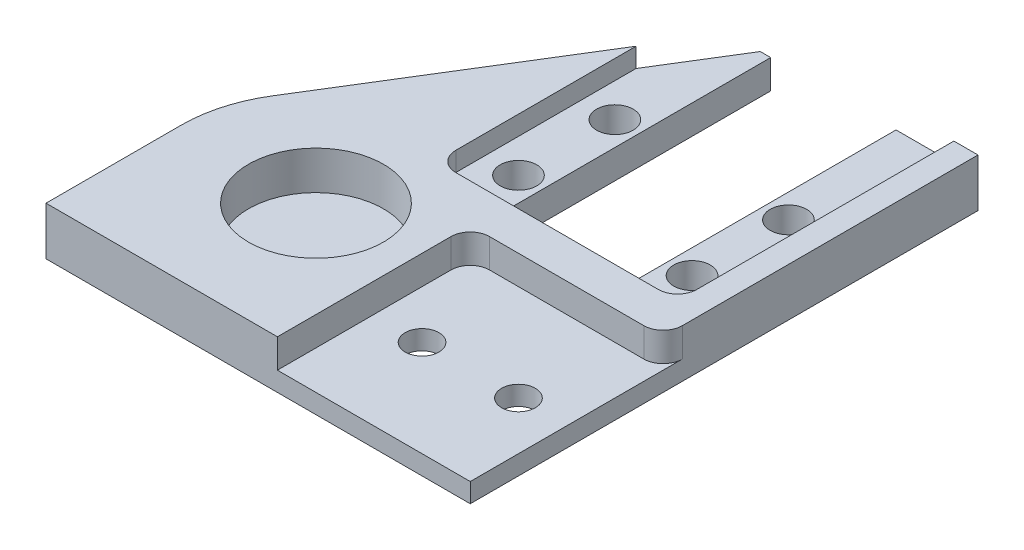
from build123d import *

# Parameters (mm, degrees)
SKETCH_1_W           = 35
SKETCH_1_H           = 55
EXTRUDE_1_DEPTH      = 1
EXTRUDE_2_DEPTH      = 3
SKETCH_3_R           = 5
CUT_EXTRUDE_1_DEPTH  = 169.569903897
SKETCH_4_R           = 4
CUT_EXTRUDE_2_DEPTH  = 2
SKETCH_5_R           = 2
CUT_EXTRUDE_3_DEPTH  = 2
EXTRUDE_START        = 7
EXTRUDE_3_DEPTH      = 7
CUT_EXTRUDE_START    = -1.5
SKETCH_9_W           = 10
SKETCH_9_H           = 26
CUT_EXTRUDE_4_DEPTH  = 168.318874833
SKETCH_10_R          = 1.5
CUT_EXTRUDE_5_DEPTH  = 194.595583627
EXTRUDE_4_DEPTH      = 3
SKETCH_13_W          = 334.012533363
SKETCH_13_H          = 161.456209481
CUT_EXTRUDE_6_DEPTH  = 10
CUT_EXTRUDE_START_2  = -0.5
SKETCH_14_R          = 3.5
CUT_EXTRUDE_7_DEPTH  = 179.354165453
SKETCH_15_R          = 5
CUT_EXTRUDE_8_DEPTH  = 179.854165453
EXTRUDE_START_2      = -3
EXTRUDE_5_DEPTH      = 16
EXTRUDE_7_DEPTH      = 7
SKETCH_24_W          = 10
SKETCH_24_H          = 26
CUT_EXTRUDE_11_DEPTH = 180.209193181
SKETCH_25_R          = 1.5
CUT_EXTRUDE_12_DEPTH = 176.793913433
THREAD_2_PITCH       = 0.6
CUT_EXTRUDE_13_DEPTH = 181.709193232
EXTRUDE_START_3      = 2
SKETCH_27_R          = 5
EXTRUDE_8_DEPTH      = 2
CUT_EXTRUDE_START_3  = -2
SKETCH_28_W          = 25
SKETCH_28_H          = 47.640496167
CUT_EXTRUDE_14_DEPTH = 182.247184378
SKETCH_29_R          = 7
CUT_EXTRUDE_15_DEPTH = 4
CUT_EXTRUDE_16_DEPTH = 10
SKETCH_32_R          = 1.896812978
CUT_EXTRUDE_17_DEPTH = 10
CUT_EXTRUDE_START_4  = -19
CUT_EXTRUDE_18_DEPTH = 2
CUT_EXTRUDE_19_DEPTH = 180.762490825
CUT_EXTRUDE_20_DEPTH = 176.782687167
CUT_EXTRUDE_21_DEPTH = 175.343166372
SKETCH_37_R          = 1
CUT_EXTRUDE_22_DEPTH = 175.199743974
EXTRUDE_START_4      = -1
SKETCH_39_R          = 5
EXTRUDE_9_DEPTH      = 1
SKETCH_40_W          = 2.395962652
SKETCH_40_H          = 5.687033247
CUT_EXTRUDE_23_DEPTH = 192.518571686
SKETCH_41_W          = 84.482618637
SKETCH_41_H          = 34.951738984
CUT_EXTRUDE_24_DEPTH = 192.518571686
SKETCH_42_W          = 20
SKETCH_42_H          = 3
CUT_EXTRUDE_25_DEPTH = 20
CUT_EXTRUDE_26_DEPTH = 20
FILLET_1_R           = 2
FILLET_2_R           = 2


with BuildPart() as part:
    # 草图1 → 凸台-拉伸1 (new body)
    with BuildSketch(Plane(origin=(0, 0, 0), x_dir=(1, 0, 0), z_dir=(0, 1, 0))):
        Rectangle(SKETCH_1_W, SKETCH_1_H)
    extrude(amount=EXTRUDE_1_DEPTH)

    # Sketch 2 → 凸台-拉伸2 (add)
    with BuildSketch(Plane(origin=(0, 1, 0), x_dir=(1, 0, 0), z_dir=(0, 1, 0))):
        with BuildLine():
            Line((106.75, -2.25), (106.75, 2.25))
            Line((106.75, 2.25), (121.75, 2.25))
            ThreePointArc((121.75, 2.25), (122.922125199, 2.352547667), (124.058635967, 2.65707481))
            Line((124.058635967, 2.65707481), (154.058635967, 13.576181838))
            ThreePointArc((154.058635967, 13.576181838), (158.397452333, 21.091232227), (151.75, 26.669107028))
            Line((151.75, 26.669107028), (-31.447415548, 57.101298968))
            ThreePointArc((-31.447415548, 57.101298968), (-37.800418235, 56.264673928), (-42.609265279, 52.029632639))
            Line((-42.609265279, 52.029632639), (-60.161792173, 23.605896086))
            ThreePointArc((-60.161792173, 23.605896086), (-61.717833724, 20.073278016), (-62.25, 16.25))
            Line((-62.25, 16.25), (-62.25, -16.25))
            ThreePointArc((-62.25, -16.25), (-61.717833724, -20.073278016), (-60.161792173, -23.605896086))
            Line((-60.161792173, -23.605896086), (-42.609265279, -52.029632639))
            ThreePointArc((-42.609265279, -52.029632639), (-37.800418235, -56.264673928), (-31.447415548, -57.101298968))
            Line((-31.447415548, -57.101298968), (151.75, -26.669107028))
            ThreePointArc((151.75, -26.669107028), (158.397452333, -21.091232227), (154.058635967, -13.576181838))
            Line((154.058635967, -13.576181838), (124.058635967, -2.65707481))
            ThreePointArc((124.058635967, -2.65707481), (122.922125199, -2.352547667), (121.75, -2.25))
            Line((121.75, -2.25), (106.75, -2.25))
        make_face()
    extrude(amount=EXTRUDE_2_DEPTH)

    # 草图3 → 切除-拉伸1 (cut, through all)
    with BuildSketch(Plane(origin=(0, 4, 0), x_dir=(1, 0, 0), z_dir=(0, 1, 0))):
        with Locations(Location((-48.25, 16.25, 0), (0, 0, 270))):
            Circle(SKETCH_3_R)
        with Locations(Location((-48.25, -16.25, 0), (0, 0, 270))):
            Circle(SKETCH_3_R)
    extrude(amount=-CUT_EXTRUDE_1_DEPTH, mode=Mode.SUBTRACT)

    # 草图4 → 切除-拉伸2 (cut)
    with BuildSketch(Plane(origin=(0, 4, 0), x_dir=(1, 0, 0), z_dir=(0, 1, 0))):
        with Locations(Location((-33.25, 46.25, 0), (0, 0, 270))):
            Circle(SKETCH_4_R)
        with Locations(Location((-33.25, -46.25, 0), (0, 0, 270))):
            Circle(SKETCH_4_R)
    extrude(amount=-CUT_EXTRUDE_2_DEPTH, mode=Mode.SUBTRACT)

    # 草图5 → 切除-拉伸3 (cut)
    with BuildSketch(Plane(origin=(0, 4, 0), x_dir=(1, 0, 0), z_dir=(0, 1, 0))):
        with Locations(Location((121.75, 9, 0), (0, 0, 270))):
            Circle(SKETCH_5_R)
        with Locations(Location((121.75, -9, 0), (0, 0, 270))):
            Circle(SKETCH_5_R)
        with Locations(Location((151.75, 19.919107028, 0), (0, 0, 270))):
            Circle(SKETCH_5_R)
        with Locations(Location((151.75, -19.919107028, 0), (0, 0, 270))):
            Circle(SKETCH_5_R)
    extrude(amount=-CUT_EXTRUDE_3_DEPTH, mode=Mode.SUBTRACT)

    # 草图8 → 凸台-拉伸3 (add)
    with BuildSketch(Plane.XZ.offset(-1).offset(EXTRUDE_START)):
        with BuildLine():
            Line((-26.75, -26.25), (-39.75, -26.25))
            Line((-39.75, -26.25), (-39.75, -55.124119675))
            ThreePointArc((-39.75, -55.124119675), (-35.798281322, -56.950759894), (-31.447415548, -57.101298968))
            Line((-31.447415548, -57.101298968), (-26.75, -56.320978726))
            Line((-26.75, -56.320978726), (-26.75, -26.25))
        make_face()
    extrude_3 = extrude(amount=-EXTRUDE_3_DEPTH)

    # 镜向1: 凸台-拉伸3 across plane
    add(extrude_3.mirror(Plane.XY))

    # 草图9 → 切除-拉伸4 (cut, through all)
    with BuildSketch(Plane.XZ.offset(6).offset(CUT_EXTRUDE_START)):
        with Locations((-33.25, -40.75)):
            Rectangle(SKETCH_9_W, SKETCH_9_H)
    cut_extrude_4 = extrude(amount=-CUT_EXTRUDE_4_DEPTH, mode=Mode.SUBTRACT)

    # 镜向2: 切除-拉伸4 across plane
    add(cut_extrude_4.mirror(Plane.XY), mode=Mode.SUBTRACT)

    # 草图10 → 切除-拉伸5 (cut, through all)
    with BuildSketch(Plane.XY.offset(-53.75)):
        with Locations((-33.25, -1.5)):
            Circle(SKETCH_10_R)
    cut_extrude_5 = extrude(amount=-CUT_EXTRUDE_5_DEPTH, mode=Mode.SUBTRACT)

    # 镜向3: 切除-拉伸5 across plane
    add(cut_extrude_5.mirror(Plane.XY), mode=Mode.SUBTRACT)

    # 草图12 → 凸台-拉伸4 (add)
    with BuildSketch(Plane(origin=(0, 4, 0), x_dir=(1, 0, 0), z_dir=(0, 1, 0))):
        with BuildLine():
            Line((152.536154407, 34.648141662), (-30.136445037, 64.993152763))
            ThreePointArc((-30.136445037, 64.993152763), (-32.296727103, 65.226071005), (-34.469475839, 65.210824842))
            Line((-34.469475839, 65.210824842), (-60.161792173, 23.605896086))
            ThreePointArc((-60.161792173, 23.605896086), (-61.717833724, 20.073278016), (-62.25, 16.25))
            Line((-62.25, 16.25), (-62.25, 2.25))
            Line((-62.25, 2.25), (121.75, 2.25))
            ThreePointArc((121.75, 2.25), (122.922125199, 2.352547667), (124.058635967, 2.65707481))
            Line((124.058635967, 2.65707481), (166.382589153, 18.061733966))
            ThreePointArc((166.382589153, 18.061733966), (163.073058037, 29.371665237), (152.536154407, 34.648141662))
        make_face()
    extrude(amount=EXTRUDE_4_DEPTH)

    # 草图13 → 切除-拉伸6 (cut)
    with BuildSketch(Plane.XZ.offset(-4)):
        with Locations((47.836319436, 6.16656882)):
            Rectangle(SKETCH_13_W, SKETCH_13_H)
    extrude(amount=CUT_EXTRUDE_6_DEPTH, mode=Mode.SUBTRACT)

    # 草图14 → 切除-拉伸7 (cut, through all)
    with BuildSketch(Plane.XZ.offset(-4).offset(CUT_EXTRUDE_START_2)):
        with Locations(Location((151.75, -19.919107028, 0), (0, 0, 270))):
            Circle(SKETCH_14_R)
        with Locations(Location((121.75, -9, 0), (0, 0, 270))):
            Circle(SKETCH_14_R)
    extrude(amount=-CUT_EXTRUDE_7_DEPTH, mode=Mode.SUBTRACT)

    # 草图15 → 切除-拉伸8 (cut, through all)
    with BuildSketch(Plane.XZ.offset(-4)):
        with Locations(Location((-48.25, -16.25, 0), (0, 0, 270))):
            Circle(SKETCH_15_R)
    extrude(amount=-CUT_EXTRUDE_8_DEPTH, mode=Mode.SUBTRACT)

    # 草图17 → 凸台-拉伸5 (add)
    with BuildSketch(Plane.XZ.offset(-4).offset(EXTRUDE_START_2)):
        with BuildLine():
            Line((-30.628058978, -62.03370759), (152.218782473, -31.659751942))
            ThreePointArc((152.218782473, -31.659751942), (161.216553887, -26.879484712), (163.096310198, -16.865626245))
            Line((163.096310198, -16.865626245), (166.382589153, -18.061733966))
            ThreePointArc((166.382589153, -18.061733966), (163.073058037, -29.371665237), (152.536154407, -34.648141662))
            Line((152.536154407, -34.648141662), (-30.136445037, -64.993152763))
            ThreePointArc((-30.136445037, -64.993152763), (-32.296727103, -65.226071005), (-34.469475839, -65.210824842))
            Line((-34.469475839, -65.210824842), (-36.504423199, -61.915526791))
            ThreePointArc((-36.504423199, -61.915526791), (-33.571714316, -62.246765295), (-30.628058978, -62.03370759))
        make_face()
    extrude(amount=-EXTRUDE_5_DEPTH)

    # 草图23 → 凸台-拉伸7 (add)
    with BuildSketch(Plane.XZ.offset(-4).offset(EXTRUDE_START)):
        with BuildLine():
            Line((-39.75, -56.65979236), (-39.75, -26.25))
            Line((-39.75, -26.25), (-26.75, -26.25))
            Line((-26.75, -26.25), (-26.75, -64.430606916))
            Line((-26.75, -64.430606916), (-30.136445037, -64.993152763))
            ThreePointArc((-30.136445037, -64.993152763), (-32.296727103, -65.226071005), (-34.469475839, -65.210824842))
            Line((-34.469475839, -65.210824842), (-39.75, -56.65979236))
        make_face()
    extrude(amount=-EXTRUDE_7_DEPTH)

    # 草图24 → 切除-拉伸11 (cut, through all)
    with BuildSketch(Plane.XZ.offset(3).offset(CUT_EXTRUDE_START)):
        with Locations((-33.25, -40.75)):
            Rectangle(SKETCH_24_W, SKETCH_24_H)
    extrude(amount=-CUT_EXTRUDE_11_DEPTH, mode=Mode.SUBTRACT)

    # 草图25 → 切除-拉伸12 (cut, through all)
    with BuildSketch(Plane.XY.offset(-53.75)):
        with Locations((-33.25, 1.5)):
            Circle(SKETCH_25_R)
    extrude(amount=-CUT_EXTRUDE_12_DEPTH, mode=Mode.SUBTRACT)

    # 螺纹线2: the profile of Sketch 2 2 profile screwed along a right-hand helix of 25 turns, 6 arcs to a turn; built about Z, then put on its axis
    thread_2_z = Axis((0, 0, 0), (0, 0, 1))
    thread_2_corners = [(1.4997, 0, -0.000173205), (1.824759525, 0, 0.187499999), (1.824759525, 0, 0.262499999), (1.4997, 0, 0.450173203)]
    with BuildLine(mode=Mode.PRIVATE) as thread_2_profile:
        Line(thread_2_corners[0], thread_2_corners[1])
        Line(thread_2_corners[1], thread_2_corners[2])
        Line(thread_2_corners[2], thread_2_corners[3])
        Line(thread_2_corners[3], thread_2_corners[0])
    thread_2_cap = Face(thread_2_profile.wire())
    thread_2_turn_angles = [0, 30, 60, 90, 120, 150, 180, 210, 240, 270, 300, 330, 360]
    thread_2_turn_weights = [1, 0.8660254037844387, 1, 0.8660254037844387, 1, 0.8660254037844387, 1, 0.8660254037844387, 1, 0.8660254037844387, 1, 0.8660254037844387, 1]
    thread_2_turn_rails = [Edge.make_bspline([Vector(p[0], p[1], 0).rotate(thread_2_z, thread_2_turn_angles[k]) / thread_2_turn_weights[k] + Vector(0, 0, p[2] + THREAD_2_PITCH * thread_2_turn_angles[k] / 360) for k in range(13)], [0, 0, 0, 1, 1, 2, 2, 3, 3, 4, 4, 5, 5, 6, 6, 6], 2, thread_2_turn_weights) for p in thread_2_corners]
    thread_2_turn_sides = [Face.make_surface_from_curves(thread_2_turn_rails[p[0]], thread_2_turn_rails[p[1]]) for p in [(0, 1), (1, 2), (2, 3), (3, 0)]]
    thread_2 = Plane(origin=(-33.25, 1.5, -53.75), x_dir=(-1, 0, 0), z_dir=(0, 0, -1)) * Solid(Shell([*[p.moved(Location((0, 0, THREAD_2_PITCH * i))) for i in range(25) for p in thread_2_turn_sides], thread_2_cap, thread_2_cap.rotate(thread_2_z, 9000).moved(Location((0, 0, THREAD_2_PITCH * 9000 / 360)))]))
    add(thread_2, mode=Mode.SUBTRACT)

    # 草图26 → 切除-拉伸13 (cut, through all)
    with BuildSketch(Plane.XZ.offset(3)):
        with BuildLine():
            Line((-26.75, -64.430606916), (-26.75, -26.25))
            Line((-26.75, -26.25), (-39.75, -26.25))
            Line((-39.75, -26.25), (-39.75, -56.65979236))
            Line((-39.75, -56.65979236), (-34.469475839, -65.210824842))
            ThreePointArc((-34.469475839, -65.210824842), (-32.296727103, -65.226071005), (-30.136445037, -64.993152763))
            Line((-30.136445037, -64.993152763), (-26.75, -64.430606916))
        make_face()
    extrude(amount=-CUT_EXTRUDE_13_DEPTH, mode=Mode.SUBTRACT)

    # 草图27 → 凸台-拉伸8 (add)
    with BuildSketch(Plane.XZ.offset(-4).offset(EXTRUDE_START_3)):
        with BuildLine():
            Line((-39.75, -56.65979236), (-39.75, -26.25))
            Line((-39.75, -26.25), (-26.75, -26.25))
            Line((-26.75, -26.25), (-26.75, -64.430606916))
            Line((-26.75, -64.430606916), (-18.25, -63.018613025))
            Line((-18.25, -63.018613025), (-18.25, -2.25))
            Line((-18.25, -2.25), (-62.25, -2.25))
            Line((-62.25, -2.25), (-62.25, -16.25))
            ThreePointArc((-62.25, -16.25), (-61.717833724, -20.073278016), (-60.161792173, -23.605896086))
            Line((-60.161792173, -23.605896086), (-39.75, -56.65979236))
        make_face()
        with Locations(Location((-48.25, -16.25, 0), (0, 0, 270))):
            Circle(SKETCH_27_R, mode=Mode.SUBTRACT)
    extrude(amount=-EXTRUDE_8_DEPTH)

    # 草图28 → 切除-拉伸14 (cut, through all)
    with BuildSketch(Plane(origin=(0, 7, 0), x_dir=(1, 0, 0), z_dir=(0, 1, 0)).offset(CUT_EXTRUDE_START_3)):
        with Locations((-33.25, 50.070248084)):
            Rectangle(SKETCH_28_W, SKETCH_28_H)
    extrude(amount=CUT_EXTRUDE_14_DEPTH, mode=Mode.SUBTRACT)

    # 草图29 → 切除-拉伸15 (cut)
    with BuildSketch(Plane(origin=(0, 7, 0), x_dir=(1, 0, 0), z_dir=(0, 1, 0))):
        with Locations(Location((-48.25, 16.25, 0), (0, 0, 270))):
            Circle(SKETCH_29_R)
    extrude(amount=-CUT_EXTRUDE_15_DEPTH, mode=Mode.SUBTRACT)

    # 草图31 → 切除-拉伸16 (cut)
    with BuildSketch(Plane.XZ.offset(-4)):
        with BuildLine():
            Line((7.5, -16.25), (0, -16.25))
            ThreePointArc((0, -16.25), (0.512563133, -17.487436867), (1.75, -18))
            Line((1.75, -18), (5.75, -18))
            ThreePointArc((5.75, -18), (6.987436867, -17.487436867), (7.5, -16.25))
        make_face()
        with BuildLine():
            ThreePointArc((1.75, -14.5), (0.512563133, -15.012563133), (0, -16.25))
            Line((0, -16.25), (7.5, -16.25))
            ThreePointArc((7.5, -16.25), (6.987436867, -15.012563133), (5.75, -14.5))
            Line((5.75, -14.5), (1.75, -14.5))
        make_face()
        with BuildLine():
            Line((47.5, -16.25), (40, -16.25))
            ThreePointArc((40, -16.25), (40.512563133, -17.487436867), (41.75, -18))
            Line((41.75, -18), (45.75, -18))
            ThreePointArc((45.75, -18), (46.987436867, -17.487436867), (47.5, -16.25))
        make_face()
        with BuildLine():
            ThreePointArc((41.75, -14.5), (40.512563133, -15.012563133), (40, -16.25))
            Line((40, -16.25), (47.5, -16.25))
            ThreePointArc((47.5, -16.25), (46.987436867, -15.012563133), (45.75, -14.5))
            Line((45.75, -14.5), (41.75, -14.5))
        make_face()
        with BuildLine():
            ThreePointArc((81.75, -14.5), (80.512563133, -15.012563133), (80, -16.25))
            Line((80, -16.25), (87.5, -16.25))
            ThreePointArc((87.5, -16.25), (86.987436867, -15.012563133), (85.75, -14.5))
            Line((85.75, -14.5), (81.75, -14.5))
        make_face()
        with BuildLine():
            Line((87.5, -16.25), (80, -16.25))
            ThreePointArc((80, -16.25), (80.512563133, -17.487436867), (81.75, -18))
            Line((81.75, -18), (85.75, -18))
            ThreePointArc((85.75, -18), (86.987436867, -17.487436867), (87.5, -16.25))
        make_face()
        with BuildLine():
            Line((0, -31.25), (0, -35.25))
            ThreePointArc((0, -35.25), (1.75, -37), (3.5, -35.25))
            Line((3.5, -35.25), (3.5, -31.25))
            ThreePointArc((3.5, -31.25), (1.75, -29.5), (0, -31.25))
        make_face()
    extrude(amount=-CUT_EXTRUDE_16_DEPTH, mode=Mode.SUBTRACT)

    # 草图32 → 切除-拉伸17 (cut)
    with BuildSketch(Plane(origin=(0, 5, 0), x_dir=(1, 0, 0), z_dir=(0, 1, 0))):
        with Locations(Location((-42.25, 41.25, 0), (0, 0, 270))):
            Circle(SKETCH_32_R)
        with Locations(Location((-42.25, 31.25, 0), (0, 0, 270))):
            Circle(SKETCH_32_R)
        with Locations(Location((-24.25, 41.25, 0), (0, 0, 270))):
            Circle(SKETCH_32_R)
        with Locations(Location((-24.25, 31.25, 0), (0, 0, 270))):
            Circle(SKETCH_32_R)
    extrude(amount=-CUT_EXTRUDE_17_DEPTH, mode=Mode.SUBTRACT)

    # 草图33 → 切除-拉伸18 (cut)
    with BuildSketch(Plane(origin=(0, 23, 0), x_dir=(1, 0, 0), z_dir=(0, 1, 0)).offset(CUT_EXTRUDE_START_4)):
        with BuildLine():
            Line((-26.75, 56.320978726), (151.75, 26.669107028))
            ThreePointArc((151.75, 26.669107028), (158.397452333, 21.091232227), (154.058635967, 13.576181838))
            Line((154.058635967, 13.576181838), (163.096310198, 16.865626245))
            Line((163.096310198, 16.865626245), (166.382589153, 18.061733966))
            ThreePointArc((166.382589153, 18.061733966), (163.073058037, 29.371665237), (152.536154407, 34.648141662))
            Line((152.536154407, 34.648141662), (-20.75, 63.433905346))
            Line((-20.75, 63.433905346), (-26.75, 64.430606916))
            Line((-26.75, 64.430606916), (-26.75, 56.320978726))
        make_face()
    extrude(amount=CUT_EXTRUDE_18_DEPTH, mode=Mode.SUBTRACT)

    # 草图34 → 切除-拉伸19 (cut, through all)
    with BuildSketch(Plane(origin=(0, 23, 0), x_dir=(1, 0, 0), z_dir=(0, 1, 0))):
        with BuildLine():
            Line((152.536154407, 34.648141662), (-20.75, 63.433905346))
            Line((-20.75, 63.433905346), (-20.75, 60.392794775))
            Line((-20.75, 60.392794775), (152.218782473, 31.659751942))
            ThreePointArc((152.218782473, 31.659751942), (161.216553887, 26.879484712), (163.096310198, 16.865626245))
            Line((163.096310198, 16.865626245), (166.382589153, 18.061733966))
            ThreePointArc((166.382589153, 18.061733966), (163.073058037, 29.371665237), (152.536154407, 34.648141662))
        make_face()
    extrude(amount=-CUT_EXTRUDE_19_DEPTH, mode=Mode.SUBTRACT)

    # 草图35 → 切除-拉伸20 (cut, through all)
    with BuildSketch(Plane.XZ.offset(-6)):
        Polygon((-20.75, -60.392794775), (-20.75, -55.324277157), (-34.501982631, -57.608714269), (-32.134133376, -71.862825995), (-8.577554705, -67.949679505), (-10.126047391, -58.627976401), align=None)
        Polygon((-10.94540396, -53.695567779), (-20.75, -55.324277157), (-20.75, -60.392794775), (-10.126047391, -58.627976401), align=None)
    extrude(amount=CUT_EXTRUDE_20_DEPTH, mode=Mode.SUBTRACT)

    # 草图36 → 切除-拉伸21 (cut, through all)
    with BuildSketch(Plane.XZ.offset(-6)):
        Polygon((-18.25, -54.908984836), (-18.25, -59.977502454), (-20.75, -60.392794775), (-20.75, -55.324277157), align=None)
    extrude(amount=-CUT_EXTRUDE_21_DEPTH, mode=Mode.SUBTRACT)

    # 草图37 → 切除-拉伸22 (cut, through all)
    with BuildSketch(Plane.XZ.offset(-6)):
        with BuildLine():
            ThreePointArc((12.330933455, -52.363232915), (11.180580417, -51.540622505), (10.357970006, -52.690975543))
            Line((10.357970006, -52.690975543), (12.330933455, -52.363232915))
        make_face()
        with BuildLine():
            Line((12.330933455, -52.363232915), (10.357970006, -52.690975543))
            ThreePointArc((10.357970006, -52.690975543), (11.426665707, -53.52371893), (12.344451731, -52.527104229))
            ThreePointArc((12.344451731, -52.527104229), (12.341066432, -52.444890254), (12.330933455, -52.363232915))
        make_face()
        with BuildLine():
            ThreePointArc((130.708740378, -32.698675253), (129.55838734, -31.876064842), (128.73577693, -33.02641788))
            Line((128.73577693, -33.02641788), (130.708740378, -32.698675253))
        make_face()
        with BuildLine():
            Line((130.708740378, -32.698675253), (128.73577693, -33.02641788))
            ThreePointArc((128.73577693, -33.02641788), (129.80447263, -33.859161267), (130.722258654, -32.862546567))
            ThreePointArc((130.722258654, -32.862546567), (130.718873355, -32.780332591), (130.708740378, -32.698675253))
        make_face()
        with Locations(Location((50.803720705, -45.972251675, 0), (0, 0, 270))):
            Circle(SKETCH_37_R)
        with Locations(Location((90.26298968, -39.417399121, 0), (0, 0, 270))):
            Circle(SKETCH_37_R)
    extrude(amount=-CUT_EXTRUDE_22_DEPTH, mode=Mode.SUBTRACT)

    # 草图39 → 凸台-拉伸9 (add)
    with BuildSketch(Plane(origin=(0, 3, 0), x_dir=(1, 0, 0), z_dir=(0, 1, 0)).offset(EXTRUDE_START_4)):
        with Locations((-48.25, 16.25)):
            Circle(SKETCH_39_R)
    extrude(amount=EXTRUDE_9_DEPTH)

    # 草图40 → 切除-拉伸23 (cut, through all)
    with BuildSketch(Plane.ZY.offset(18.25)):
        with Locations((-56.106966162, 4.156483376)):
            Rectangle(SKETCH_40_W, SKETCH_40_H)
    extrude(amount=CUT_EXTRUDE_23_DEPTH, mode=Mode.SUBTRACT)

    # 草图41 → 切除-拉伸24 (cut, through all)
    with BuildSketch(Plane(origin=(-18.25, 0, 0), x_dir=(0, 0, -1), z_dir=(1, 0, 0))):
        with Locations((24.58815333, 3.204195378)):
            Rectangle(SKETCH_41_W, SKETCH_41_H)
    extrude(amount=CUT_EXTRUDE_24_DEPTH, mode=Mode.SUBTRACT)

    # 草图42 → 切除-拉伸25 (cut)
    with BuildSketch(Plane(origin=(-18.25, 0, 0), x_dir=(0, 0, -1), z_dir=(1, 0, 0))):
        with Locations((12.25, 5.5)):
            Rectangle(SKETCH_42_W, SKETCH_42_H)
    extrude(amount=-CUT_EXTRUDE_25_DEPTH, mode=Mode.SUBTRACT)

    # 草图43 → 切除-拉伸26 (cut)
    with BuildSketch(Plane(origin=(0, 4, 0), x_dir=(1, 0, 0), z_dir=(0, 1, 0))):
        with BuildLine():
            ThreePointArc((-35, 12.25), (-33.25, 10.5), (-31.5, 12.25))
            Line((-31.5, 12.25), (-35, 12.25))
        make_face()
        with BuildLine():
            Line((-35, 12.25), (-31.5, 12.25))
            ThreePointArc((-31.5, 12.25), (-33.25, 14), (-35, 12.25))
        make_face()
        with BuildLine():
            ThreePointArc((-25, 12.25), (-23.25, 10.5), (-21.5, 12.25))
            Line((-21.5, 12.25), (-25, 12.25))
        make_face()
        with BuildLine():
            Line((-25, 12.25), (-21.5, 12.25))
            ThreePointArc((-21.5, 12.25), (-23.25, 14), (-25, 12.25))
        make_face()
    extrude(amount=-CUT_EXTRUDE_26_DEPTH, mode=Mode.SUBTRACT)

    # 圆角1
    fillet_1_edges = [part.edges().sort_by_distance(p)[0] for p in [
        (-26.75, 3.5, -26.25),
        (-39.75, 3.5, -26.25),
        (-20.75, 6, -26.25),
        (-45.75, 6, -26.25),
    ]]
    fillet(fillet_1_edges, radius=FILLET_1_R)

    # 圆角2
    fillet_2_edges = [part.edges().sort_by_distance(p)[0] for p in [
        (-38.25, 5.5, -22.25),
        (-18.25, 5.5, -22.25),
    ]]
    fillet(fillet_2_edges, radius=FILLET_2_R)


solid = part.part
